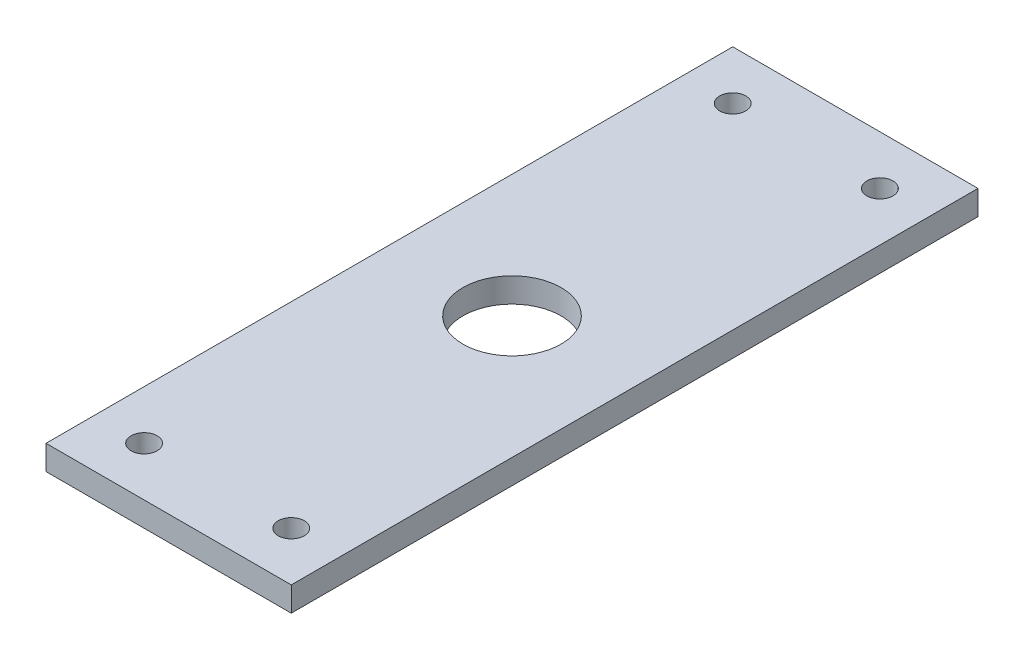
from build123d import *

# Parameters (mm, degrees)
SKETCH1_W           = 63.5
SKETCH1_H           = 177.8
SKETCH1_R           = 12.7
SKETCH1_R_2         = 3.3782
BOSS_EXTRUDE1_DEPTH = 6.35


with BuildPart() as part:
    # Sketch1 → Boss-Extrude1 (new body)
    with BuildSketch(Plane(origin=(0, 0, 0), x_dir=(1, 0, 0), z_dir=(0, 1, 0))):
        Rectangle(SKETCH1_W, SKETCH1_H)
        Circle(SKETCH1_R, mode=Mode.SUBTRACT)
        with Locations((19.05, 76.2)):
            Circle(SKETCH1_R_2, mode=Mode.SUBTRACT)
        with Locations((-19.05, 76.2)):
            Circle(SKETCH1_R_2, mode=Mode.SUBTRACT)
        with Locations((-19.05, -76.2)):
            Circle(SKETCH1_R_2, mode=Mode.SUBTRACT)
        with Locations((19.05, -76.2)):
            Circle(SKETCH1_R_2, mode=Mode.SUBTRACT)
    extrude(amount=BOSS_EXTRUDE1_DEPTH)


solid = part.part
